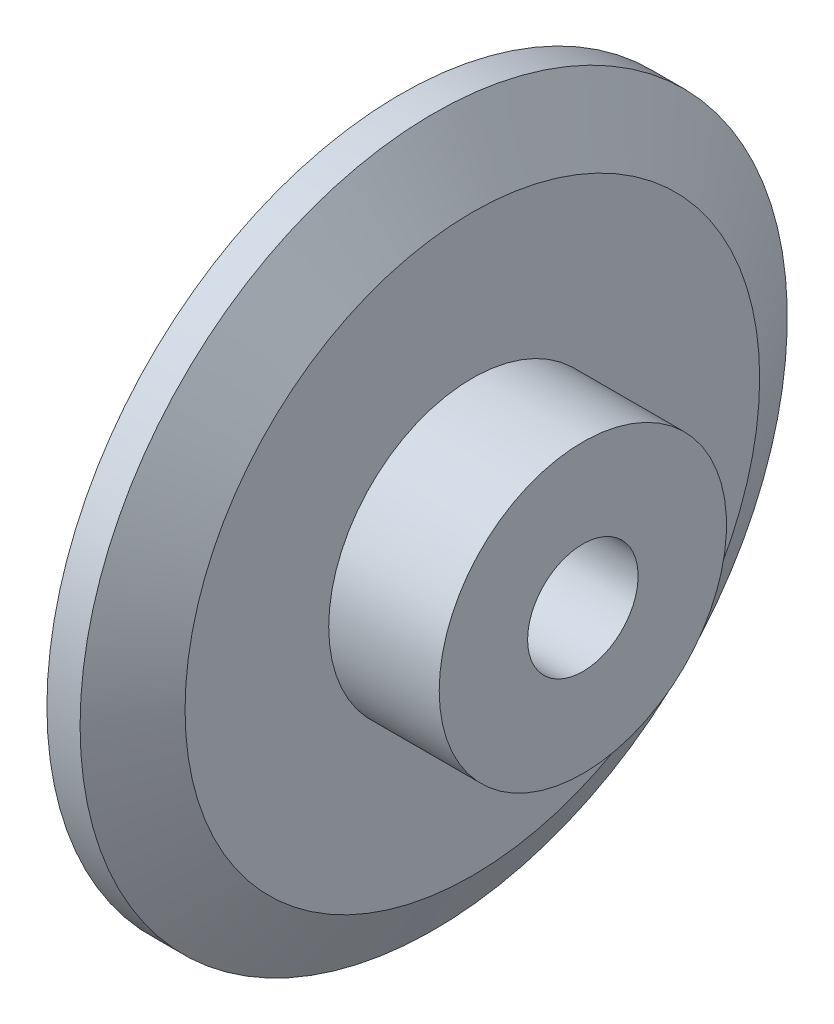
from build123d import *


with BuildPart() as part:
    # Esquisse1 → Révolution1 (revolve)
    with BuildSketch(Plane.XY):
        Polygon((-2.5, 2.5), (7.5, 2.5), (7.5, 6.5), (2.5, 6.5), (2.5, 13), (0.75, 16), (-0.75, 16), (-2.5, 13), align=None)
    revolve(axis=Axis((-14.530010417, 0, 0), (1, 0, 0)))


solid = part.part
